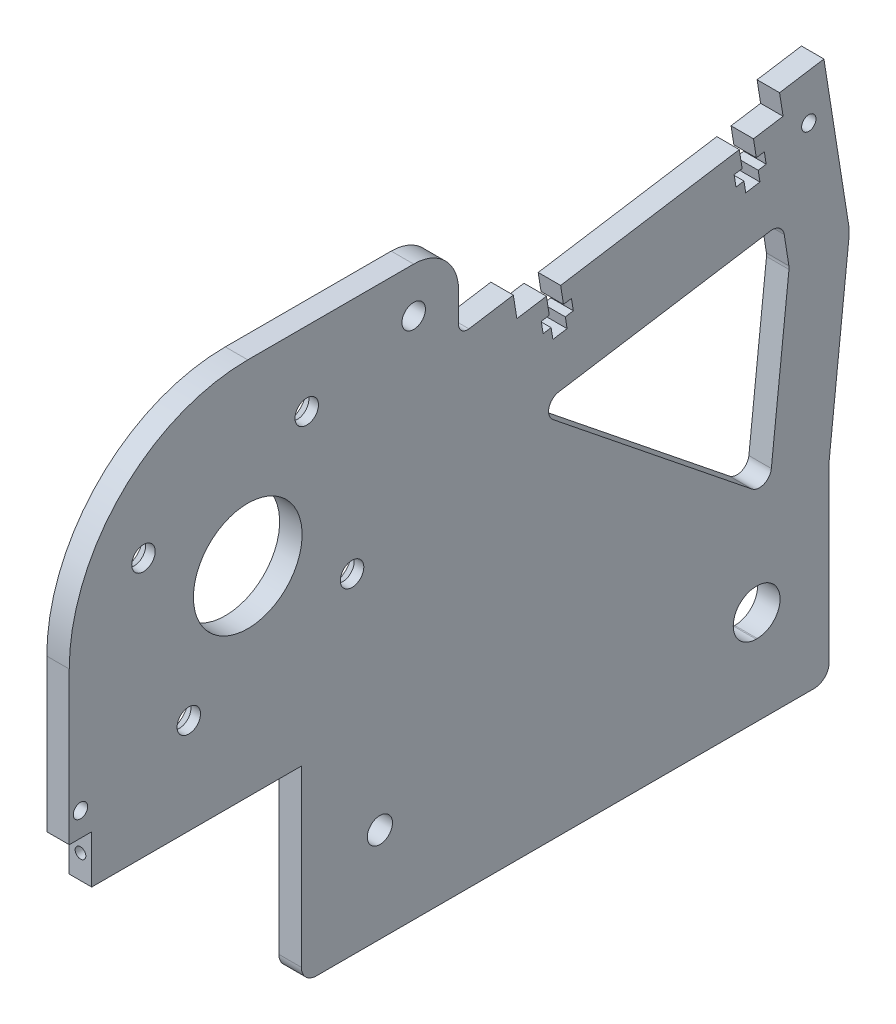
from build123d import *
from OCP.BRepFilletAPI import BRepFilletAPI_MakeChamfer

# Parameters (mm, degrees)
SKETCH1_R           = 2.4892
SKETCH1_R_2         = 2.667
SKETCH1_R_3         = 1.524
SKETCH1_R_4         = 11.522750336
BOSS_EXTRUDE1_DEPTH = 4.7625
SKETCH2_R           = 1.1303
CUT_EXTRUDE1_DEPTH  = 6.35
CHAMFER1_SIZE       = 2.7305
CHAMFER1_SIZE2      = 2.373587438


with BuildPart() as part:
    # Sketch1 → Boss-Extrude1 (new body)
    with BuildSketch(Plane(origin=(0, 0, 0), x_dir=(0, 0, -1), z_dir=(1, 0, 0))):
        with BuildLine():
            Line((-28.170295117, 0), (77.382795117, 0))
            ThreePointArc((77.382795117, 0), (79.627859148, 0.92993597), (80.557795117, 3.175))
            Line((80.557795117, 3.175), (80.557795117, 40.132))
            Line((80.557795117, 40.132), (84.771740045, 79.196103092))
            ThreePointArc((84.771740045, 79.196103092), (84.816236398, 80.272287311), (84.718413682, 81.344939685))
            Line((84.718413682, 81.344939685), (79.457064092, 114.563793628))
            Line((79.457064092, 114.563793628), (70.049332648, 113.073755348))
            Line((70.049332648, 113.073755348), (70.794351787, 108.369889626))
            Line((70.794351787, 108.369889626), (64.522530825, 107.376530773))
            Line((64.522530825, 107.376530773), (65.123512931, 103.582079091))
            Line((65.123512931, 103.582079091), (66.816904591, 103.850285981))
            Line((66.816904591, 103.850285981), (67.209281338, 101.372916701))
            Line((67.209281338, 101.372916701), (65.515889678, 101.10470981))
            Line((65.515889678, 101.10470981), (65.888399247, 98.752776949))
            Line((65.888399247, 98.752776949), (62.877925185, 98.2759647))
            Line((62.877925185, 98.2759647), (62.505415615, 100.627897561))
            Line((62.505415615, 100.627897561), (60.812023956, 100.359690671))
            Line((60.812023956, 100.359690671), (60.419647209, 102.837059951))
            Line((60.419647209, 102.837059951), (62.113038869, 103.105266841))
            Line((62.113038869, 103.105266841), (61.512056762, 106.899718524))
            Line((61.512056762, 106.899718524), (23.630258147, 100.899831052))
            Line((23.630258147, 100.899831052), (24.231240253, 97.105379369))
            Line((24.231240253, 97.105379369), (25.924631913, 97.373586259))
            Line((25.924631913, 97.373586259), (26.31700866, 94.896216979))
            Line((26.31700866, 94.896216979), (24.623617, 94.628010089))
            Line((24.623617, 94.628010089), (24.99612657, 92.276077228))
            Line((24.99612657, 92.276077228), (21.985652508, 91.799264978))
            Line((21.985652508, 91.799264978), (21.613142938, 94.151197839))
            Line((21.613142938, 94.151197839), (19.919751278, 93.882990949))
            Line((19.919751278, 93.882990949), (19.527374531, 96.360360229))
            Line((19.527374531, 96.360360229), (21.220766191, 96.62856712))
            Line((21.220766191, 96.62856712), (20.619784085, 100.423018802))
            Line((20.619784085, 100.423018802), (14.347963122, 99.429659949))
            Line((14.347963122, 99.429659949), (13.602943983, 104.133525671))
            Line((13.602943983, 104.133525671), (4.195212538, 102.643487392))
            ThreePointArc((4.195212538, 102.643487392), (2.66000635, 103.076460316), (1.992204883, 104.52503368))
            Line((1.992204883, 104.52503368), (1.992204883, 110.875))
            ThreePointArc((1.992204883, 110.875), (-0.797603027, 117.610192091), (-7.532795117, 120.4))
            Line((-7.532795117, 120.4), (-42.707795117, 120.4))
            ThreePointArc((-42.707795117, 120.4), (-69.471786785, 109.313991668), (-80.557795117, 82.55))
            Line((-80.557795117, 82.55), (-80.557795117, 50.292))
            Line((-80.557795117, 50.292), (-75.795295117, 50.292))
            Line((-75.795295117, 50.292), (-75.795295117, 40.132))
            Line((-75.795295117, 40.132), (-31.345295117, 40.132))
            Line((-31.345295117, 40.132), (-31.345295117, 3.175))
            ThreePointArc((-31.345295117, 3.175), (-30.415359148, 0.92993597), (-28.170295117, 0))
        make_face()
        with Locations((-55.209041359, 60.43939525)):
            Circle(SKETCH1_R, mode=Mode.SUBTRACT)
        with Locations((-14.692204883, 20.066)):
            Circle(SKETCH1_R_2, mode=Mode.SUBTRACT)
        with Locations((-20.597190367, 70.048753759)):
            Circle(SKETCH1_R, mode=Mode.SUBTRACT)
        with Locations((-64.818399868, 95.051246241)):
            Circle(SKETCH1_R, mode=Mode.SUBTRACT)
        with Locations((-30.206548876, 104.66060475)):
            Circle(SKETCH1_R, mode=Mode.SUBTRACT)
        with Locations((-78.176545117, 55.372)):
            Circle(SKETCH1_R_3, mode=Mode.SUBTRACT)
        with Locations((-42.707795117, 82.55)):
            Circle(SKETCH1_R_4, mode=Mode.SUBTRACT)
        with Locations((-7.532795117, 110.875)):
            Circle(SKETCH1_R, mode=Mode.SUBTRACT)
        with Locations((76.243236649, 104.411043044)):
            Circle(SKETCH1_R_3, mode=Mode.SUBTRACT)
        with BuildLine():
            Line((65.317795117, 15.2273), (65.063795117, 15.2273))
            ThreePointArc((65.063795117, 15.2273), (60.225095117, 20.066), (65.063795117, 24.9047))
            Line((65.063795117, 24.9047), (65.317795117, 24.9047))
            ThreePointArc((65.317795117, 24.9047), (70.156495117, 20.066), (65.317795117, 15.2273))
        make_face(mode=Mode.SUBTRACT)
        with BuildLine():
            Line((71.035861406, 86.549018926), (72.027193342, 80.289995416))
            ThreePointArc((72.027193342, 80.289995416), (72.057683184, 79.9556661), (72.043814352, 79.620235963))
            Line((72.043814352, 79.620235963), (68.302723543, 44.939584088))
            ThreePointArc((68.302723543, 44.939584088), (66.751491112, 42.866217372), (64.187855338, 43.230831164))
            Line((64.187855338, 43.230831164), (22.026684653, 77.057314107))
            ThreePointArc((22.026684653, 77.057314107), (21.161269703, 79.690326664), (23.218859921, 81.547211328))
            Line((23.218859921, 81.547211328), (68.12978948, 88.66040377))
            ThreePointArc((68.12978948, 88.66040377), (70.020107562, 88.206578551), (71.035861406, 86.549018926))
        make_face(mode=Mode.SUBTRACT)
    extrude(amount=BOSS_EXTRUDE1_DEPTH)

    # Sketch2 → Cut-Extrude1 (cut)
    with BuildSketch(Plane.XY.offset(75.795295117)):
        with Locations((2.38125, 45.212)):
            Circle(SKETCH2_R)
    extrude(amount=-CUT_EXTRUDE1_DEPTH, mode=Mode.SUBTRACT)

    # Chamfer1: one chamfer whose edges measure the first distance from different faces: ONE call of the kernel's chamfer builder (chamfer() names one face for all edges)
    chamfer1_edges_1 = [part.edges().sort_by_distance(p)[0] for p in [
        (0, 95.051246241, 67.307599868),
    ]]
    chamfer1_side_1 = [part.faces().sort_by_distance(p)[0] for p in [
        (2.38125, 95.051246241, 67.307599868),
    ]]
    chamfer1_edges_2 = [part.edges().sort_by_distance(p)[0] for p in [
        (0, 60.43939525, 57.698241359),
    ]]
    chamfer1_side_2 = [part.faces().sort_by_distance(p)[0] for p in [
        (2.38125, 60.43939525, 57.698241359),
    ]]
    chamfer1_edges_3 = [part.edges().sort_by_distance(p)[0] for p in [
        (0, 70.048753759, 23.086390367),
    ]]
    chamfer1_side_3 = [part.faces().sort_by_distance(p)[0] for p in [
        (2.38125, 70.048753759, 23.086390367),
    ]]
    chamfer1_edges_4 = [part.edges().sort_by_distance(p)[0] for p in [
        (0, 104.66060475, 32.695748876),
    ]]
    chamfer1_side_4 = [part.faces().sort_by_distance(p)[0] for p in [
        (2.38125, 104.66060475, 32.695748876),
    ]]
    chamfer1 = BRepFilletAPI_MakeChamfer(part.part.solid().wrapped)
    for e in chamfer1_edges_1:
        chamfer1.Add(CHAMFER1_SIZE, CHAMFER1_SIZE2, e.wrapped, chamfer1_side_1[0].wrapped)  # the first distance lies on this face
    for e in chamfer1_edges_2:
        chamfer1.Add(CHAMFER1_SIZE, CHAMFER1_SIZE2, e.wrapped, chamfer1_side_2[0].wrapped)  # the first distance lies on this face
    for e in chamfer1_edges_3:
        chamfer1.Add(CHAMFER1_SIZE, CHAMFER1_SIZE2, e.wrapped, chamfer1_side_3[0].wrapped)  # the first distance lies on this face
    for e in chamfer1_edges_4:
        chamfer1.Add(CHAMFER1_SIZE, CHAMFER1_SIZE2, e.wrapped, chamfer1_side_4[0].wrapped)  # the first distance lies on this face
    add(Compound.cast(chamfer1.Shape()), mode=Mode.REPLACE)


solid = part.part
